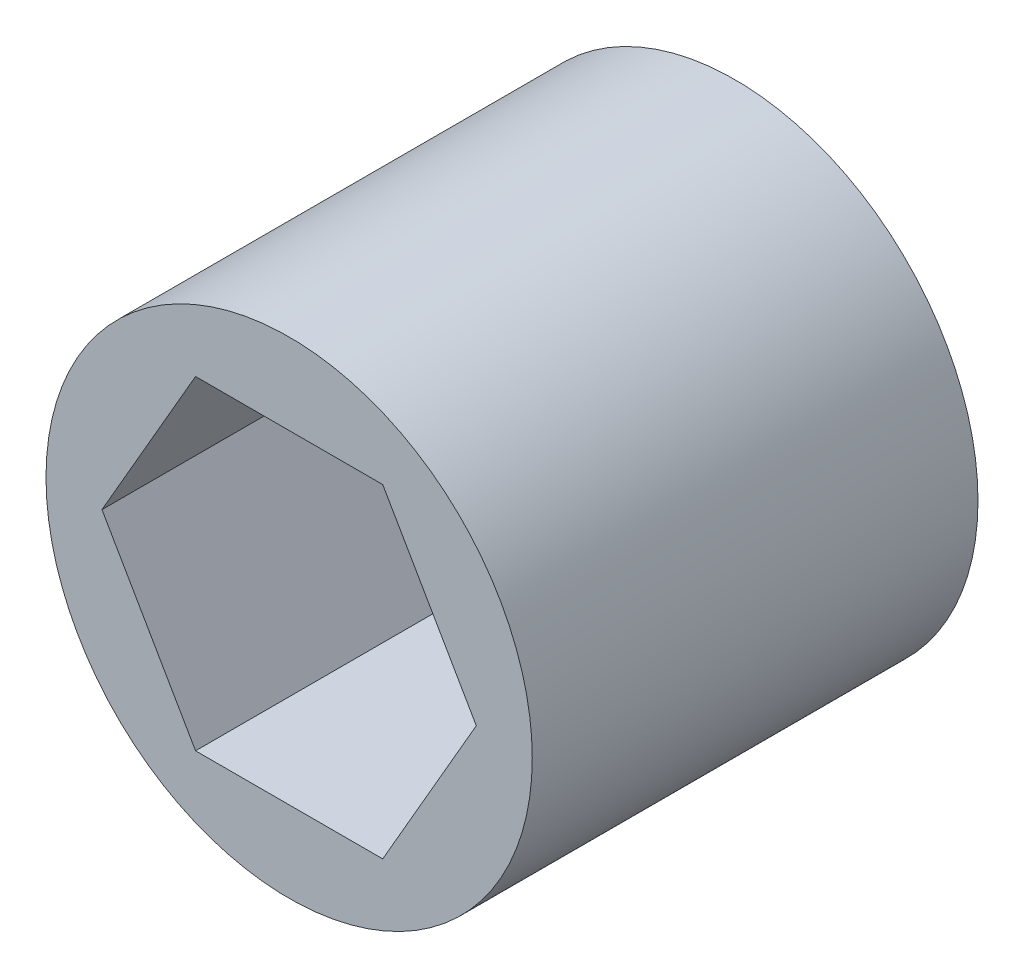
from build123d import *

# Parameters (mm, degrees)
SKETCH1_R           = 9.525
BOSS_EXTRUDE1_DEPTH = 17.4625


with BuildPart() as part:
    # Sketch1 → Boss-Extrude1 (new body)
    with BuildSketch(Plane.XY):
        Circle(SKETCH1_R)
        Polygon((-3.666174209, 6.35), (-7.332348419, 0), (-3.666174209, -6.35), (3.666174209, -6.35), (7.332348419, 0), (3.666174209, 6.35), align=None, mode=Mode.SUBTRACT)
    extrude(amount=BOSS_EXTRUDE1_DEPTH)


solid = part.part
